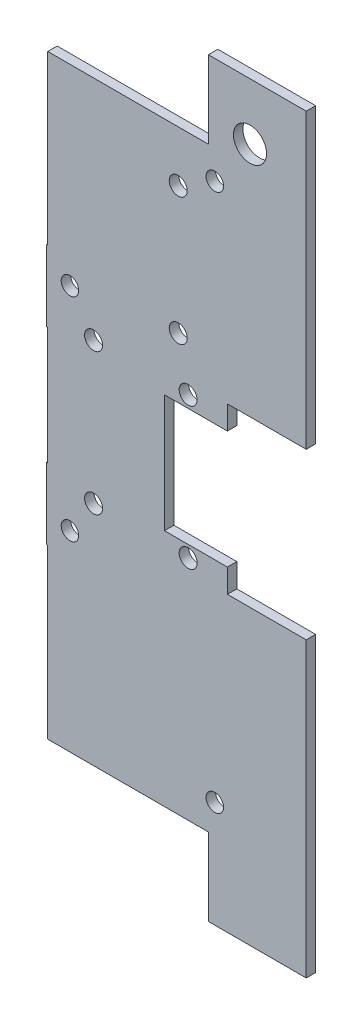
from build123d import *

# Parameters (mm, degrees)
SKETCH1_R               = 2.3495
SKETCH1_R_2             = 4.445
BOSS_EXTRUDE1_DEPTH     = 2.54
SKETCH2_R               = 2.413
CUT_EXTRUDE1_DEPTH      = 217.884748371
SKETCH3_W               = 16.89488816
SKETCH3_H               = 31.623
CUT_EXTRUDE2_DEPTH      = 217.884748371
SKETCH4_W               = 12.77569874
SKETCH4_H               = 24.435209008
SKETCH4_W_2             = 40.233428475
SKETCH4_H_2             = 28.333759116
CUT_EXTRUDE3_DEPTH      = 217.884748371
SKETCH5_R               = 2.413
CUT_EXTRUDE4_DEPTH      = 217.884748371
CUT_EXTRUDE5_DEPTH      = 217.884748371
CUT_EXTRUDE5_DEPTH_BACK = 217.884748371


with BuildPart() as part:
    # Sketch1 → Boss-Extrude1 (new body)
    with BuildSketch(Plane.XY):
        Polygon((-2.930050059, -104.509781075), (-3.314938219, -104.509781075), (-3.314938219, -110.859781075), (-3.314938219, -123.559781075), (-2.930050059, -123.559781075), (-2.930050059, -168.708281075), (38.709428475, -168.708281075), (38.709428475, -189.536281075), (105.397061781, -189.536281075), (66.517436481, -110.859781075), (45.329949941, -110.859781075), (45.329949941, -104.509781075), (45.329949941, -72.886781075), (45.329949941, -66.536781075), (66.517436481, -66.536781075), (105.397061781, 12.139718925), (38.709428475, 12.139718925), (38.709428475, -8.688281075), (-2.930050059, -8.688281075), (-2.930050059, -53.836781075), (-3.314938219, -53.836781075), (-3.314938219, -66.536781075), (-3.314938219, -72.886781075), (-2.930050059, -72.886781075), align=None)
        with Locations((90.673911143, 2.614718925)):
            Circle(SKETCH1_R, mode=Mode.SUBTRACT)
        with Locations((41.95655448, -16.435281075)):
            Circle(SKETCH1_R, mode=Mode.SUBTRACT)
        with Locations((3.035061781, -60.186781075)):
            Circle(SKETCH1_R, mode=Mode.SUBTRACT)
        with Locations((3.035061781, -117.209781075)):
            Circle(SKETCH1_R, mode=Mode.SUBTRACT)
        with Locations((41.95655448, -160.961281075)):
            Circle(SKETCH1_R, mode=Mode.SUBTRACT)
        with Locations((90.673911143, -180.011281075)):
            Circle(SKETCH1_R, mode=Mode.SUBTRACT)
        with Locations((51.409428475, -3.100281075)):
            Circle(SKETCH1_R_2, mode=Mode.SUBTRACT)
    extrude(amount=BOSS_EXTRUDE1_DEPTH)

    # Sketch2 → Cut-Extrude1 (cut, through all)
    with BuildSketch(Plane.XY.offset(2.54)):
        with Locations((9.385061781, -69.711781075)):
            Circle(SKETCH2_R)
        with Locations((34.785061781, -69.711781075)):
            Circle(SKETCH2_R)
        with Locations((34.785061781, -107.684781075)):
            Circle(SKETCH2_R)
        with Locations((9.385061781, -107.684781075)):
            Circle(SKETCH2_R)
    extrude(amount=-CUT_EXTRUDE1_DEPTH, mode=Mode.SUBTRACT)

    # Sketch3 → Cut-Extrude2 (cut, through all)
    with BuildSketch(Plane.XY.offset(2.54)):
        with Locations((36.882505861, -88.698281075)):
            Rectangle(SKETCH3_W, SKETCH3_H)
    extrude(amount=-CUT_EXTRUDE2_DEPTH, mode=Mode.SUBTRACT)

    # Sketch4 → Cut-Extrude3 (cut, through all)
    with BuildSketch(Plane.XY.offset(2.54)):
        with Locations((33.845579105, 3.529323429)):
            Rectangle(SKETCH4_W, SKETCH4_H)
        with Locations((20.116714238, -182.875160633)):
            Rectangle(SKETCH4_W_2, SKETCH4_H_2)
    extrude(amount=-CUT_EXTRUDE3_DEPTH, mode=Mode.SUBTRACT)

    # Sketch5 → Cut-Extrude4 (cut, through all)
    with BuildSketch(Plane(origin=(0, 0, 0), x_dir=(-1, 0, 0), z_dir=(0, 0, -1))):
        with Locations((-32.121949941, -22.404281075)):
            Circle(SKETCH5_R)
        with Locations((-32.121949941, -56.694281075)):
            Circle(SKETCH5_R)
    extrude(amount=-CUT_EXTRUDE4_DEPTH, mode=Mode.SUBTRACT)

    # Sketch7 → Cut-Extrude5 (cut, two sides: drawn at the far end of the back side and taken through both)
    with BuildSketch(Plane.XY.offset(2.54).offset(-CUT_EXTRUDE5_DEPTH_BACK)):
        Polygon((66.517436481, -66.536781075), (66.517436481, 21.52212206), (127.820808625, 21.52212206), (115.78217236, -200.256310461), (66.517436481, -200.256310461), (66.517436481, -110.859781075), align=None)
    extrude(amount=CUT_EXTRUDE5_DEPTH + CUT_EXTRUDE5_DEPTH_BACK, mode=Mode.SUBTRACT)


solid = part.part
